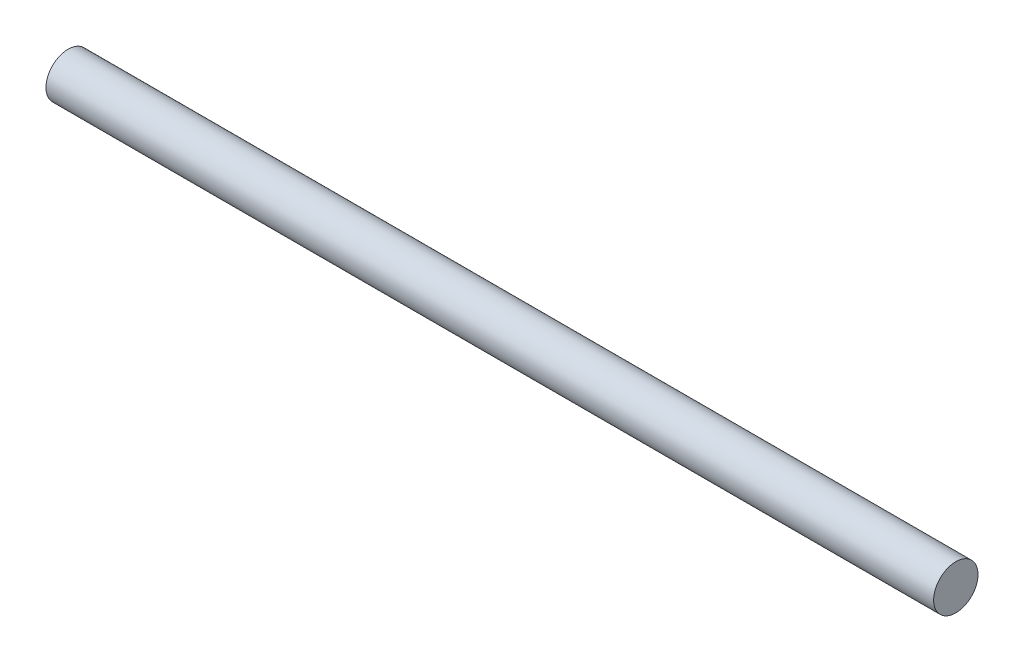
from build123d import *

# Parameters (mm, degrees)
SKETCH1_R           = 3
BOSS_EXTRUDE1_DEPTH = 120


with BuildPart() as part:
    # Sketch1 → Boss-Extrude1 (new body)
    with BuildSketch(Plane(origin=(0, 0, 0), x_dir=(0, 0, -1), z_dir=(1, 0, 0))):
        Circle(SKETCH1_R)
    extrude(amount=BOSS_EXTRUDE1_DEPTH)


solid = part.part
